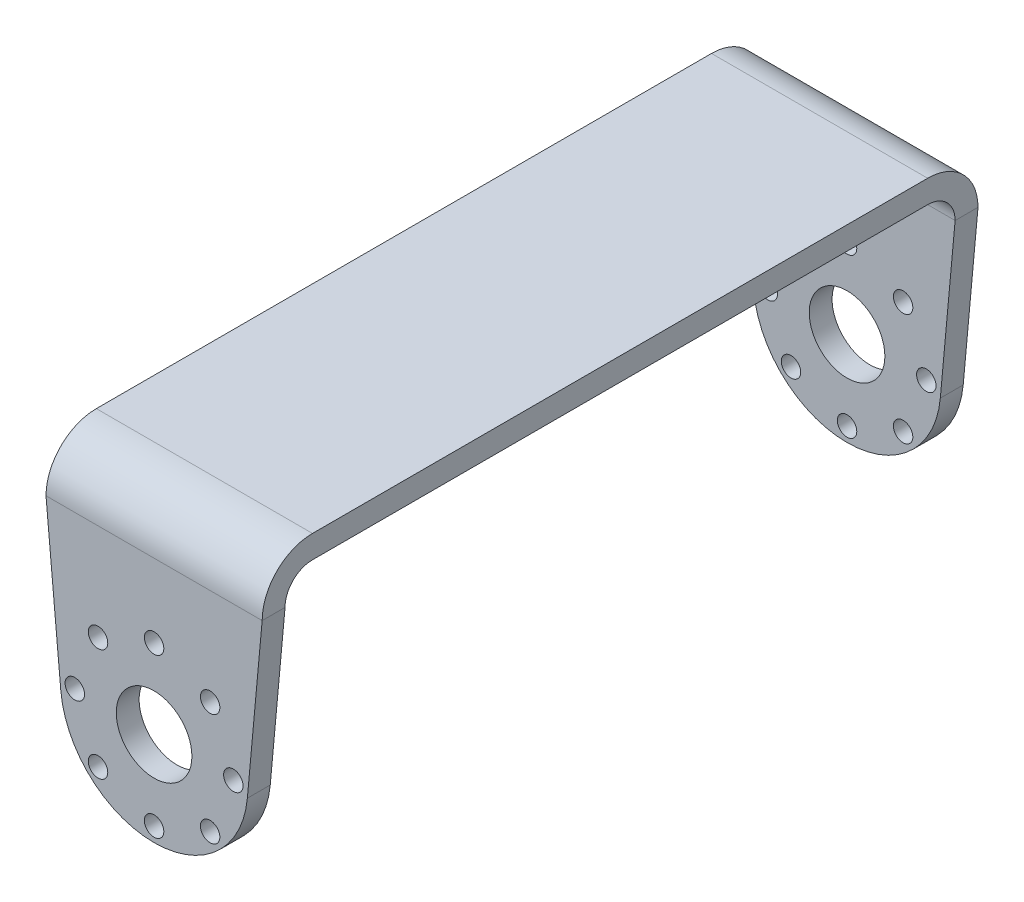
from build123d import *

# Parameters (mm, degrees)
SKETCH1_W                      = 30
SKETCH1_H                      = 93
BASE_FLANGE1_DEPTH             = 3.175
EDGE_FLANGE1_STRIP_W           = 20.32
EDGE_FLANGE1_STRIP_H           = 3.175
EDGE_FLANGE1_STRIP_CUT_DEPTH   = 30
EDGE_FLANGE1_STRIP_2_W         = 20.32
EDGE_FLANGE1_STRIP_2_H         = 3.175
EDGE_FLANGE1_STRIP_CUT_2_DEPTH = 30
EDGE_FLANGE1_DEPTH             = 30
EDGE_FLANGE1_BEND_DEPTH        = 30
CUT_EXTRUDE1_DEPTH             = 65.316449101
CUT_EXTRUDE1_DEPTH_BACK        = 65.316449101
SKETCH12_OUTSIDE_W             = 54.33
SKETCH12_OUTSIDE_H             = 65.505
SKETCH12_OUTSIDE_R             = 1.35
SKETCH12_OUTSIDE_R_2           = 5.25


# Sheet-metal steps are written as plain solids
with BuildPart() as part:
    # Sketch1 → Base-Flange1 (new body)
    with BuildSketch(Plane(origin=(0, 0, 0), x_dir=(1, 0, 0), z_dir=(0, 1, 0))):
        Rectangle(SKETCH1_W, SKETCH1_H)
    extrude(amount=BASE_FLANGE1_DEPTH)

    # Edge-Flange1 strip (across the edge) → Edge-Flange1 strip cut (cut)
    with BuildSketch(Plane(origin=(15, 0, 46.5), x_dir=(0, 0, -1), z_dir=(-1, 0, 0))):
        with Locations((-6.35, -1.5875)):
            Rectangle(EDGE_FLANGE1_STRIP_W, EDGE_FLANGE1_STRIP_H)
    extrude(amount=EDGE_FLANGE1_STRIP_CUT_DEPTH, mode=Mode.SUBTRACT)

    # Edge-Flange1 strip 2 (across the edge) → Edge-Flange1 strip cut 2 (cut)
    with BuildSketch(Plane(origin=(-15, 0, -46.5), x_dir=(0, 0, 1), z_dir=(1, 0, 0))):
        with Locations((-6.35, -1.5875)):
            Rectangle(EDGE_FLANGE1_STRIP_2_W, EDGE_FLANGE1_STRIP_2_H)
    extrude(amount=EDGE_FLANGE1_STRIP_CUT_2_DEPTH, mode=Mode.SUBTRACT)

    # Edge-Flange1 section (across the edge) → Edge-Flange1 (add)
    with BuildSketch(Plane(origin=(15, 0, 46.5), x_dir=(0, 0, -1), z_dir=(-1, 0, 0))):
        with BuildLine():
            Line((-3.175, 3.81), (-3.175, 38))
            Line((-3.175, 38), (0, 38))
            Line((0, 38), (0, 3.81))
            ThreePointArc((0, 3.81), (1.115923164, 1.115923164), (3.81, 0))
            Line((3.81, 0), (3.81, -3.175))
            ThreePointArc((3.81, -3.175), (-1.129140867, -1.129140867), (-3.175, 3.81))
        make_face()
    extrude(amount=EDGE_FLANGE1_DEPTH)

    # Edge-Flange1 section 2 (across the edge) → Edge-Flange1 bend (add)
    with BuildSketch(Plane(origin=(-15, 0, -46.5), x_dir=(0, 0, 1), z_dir=(1, 0, 0))):
        with BuildLine():
            Line((-3.175, 3.81), (-3.175, 38))
            Line((-3.175, 38), (0, 38))
            Line((0, 38), (0, 3.81))
            ThreePointArc((0, 3.81), (1.115923164, 1.115923164), (3.81, 0))
            Line((3.81, 0), (3.81, -3.175))
            ThreePointArc((3.81, -3.175), (-1.129140867, -1.129140867), (-3.175, 3.81))
        make_face()
    extrude(amount=EDGE_FLANGE1_BEND_DEPTH)

    # Sketch12 outside → Cut-Extrude1 (cut, two sides: drawn at the far end of the back side and taken through both)
    # profile 1 of 10: a face of its own
    with BuildSketch(Plane.XY.offset(-CUT_EXTRUDE1_DEPTH_BACK)):
        with Locations((0, -17.4125)):
            Rectangle(SKETCH12_OUTSIDE_W, SKETCH12_OUTSIDE_H)
        with BuildLine():
            Line((12.945561693, -26.188458018), (15, -3.81))
            Line((15, -3.81), (15, 3.175))
            Line((15, 3.175), (-15, 3.175))
            Line((-15, 3.175), (-15, -3.81))
            Line((-15, -3.81), (-12.945561693, -26.188458018))
            ThreePointArc((-12.945561693, -26.188458018), (0, -38), (12.945561693, -26.188458018))
        make_face(mode=Mode.SUBTRACT)
    # profile 2 of 10: a face of its own
    with BuildSketch(Plane.XY.offset(-CUT_EXTRUDE1_DEPTH_BACK)):
        with Locations((0, -36)):
            Circle(SKETCH12_OUTSIDE_R)
    # profile 3 of 10: a face of its own
    with BuildSketch(Plane.XY.offset(-CUT_EXTRUDE1_DEPTH_BACK)):
        with Locations((-7.778174593, -32.778174593)):
            Circle(SKETCH12_OUTSIDE_R)
    # profile 4 of 10: a face of its own
    with BuildSketch(Plane.XY.offset(-CUT_EXTRUDE1_DEPTH_BACK)):
        with Locations((-11, -25)):
            Circle(SKETCH12_OUTSIDE_R)
    # profile 5 of 10: a face of its own
    with BuildSketch(Plane.XY.offset(-CUT_EXTRUDE1_DEPTH_BACK)):
        with Locations((-7.778174593, -17.221825407)):
            Circle(SKETCH12_OUTSIDE_R)
    # profile 6 of 10: a face of its own
    with BuildSketch(Plane.XY.offset(-CUT_EXTRUDE1_DEPTH_BACK)):
        with Locations((0, -14)):
            Circle(SKETCH12_OUTSIDE_R)
    # profile 7 of 10: a face of its own
    with BuildSketch(Plane.XY.offset(-CUT_EXTRUDE1_DEPTH_BACK)):
        with Locations((7.778174593, -17.221825407)):
            Circle(SKETCH12_OUTSIDE_R)
    # profile 8 of 10: a face of its own
    with BuildSketch(Plane.XY.offset(-CUT_EXTRUDE1_DEPTH_BACK)):
        with Locations((11, -25)):
            Circle(SKETCH12_OUTSIDE_R)
    # profile 9 of 10: a face of its own
    with BuildSketch(Plane.XY.offset(-CUT_EXTRUDE1_DEPTH_BACK)):
        with Locations((7.778174593, -32.778174593)):
            Circle(SKETCH12_OUTSIDE_R)
    # profile 10 of 10: a face of its own
    with BuildSketch(Plane.XY.offset(-CUT_EXTRUDE1_DEPTH_BACK)):
        with Locations((0, -25)):
            Circle(SKETCH12_OUTSIDE_R_2)
    extrude(amount=CUT_EXTRUDE1_DEPTH + CUT_EXTRUDE1_DEPTH_BACK, mode=Mode.SUBTRACT)


solid = part.part
